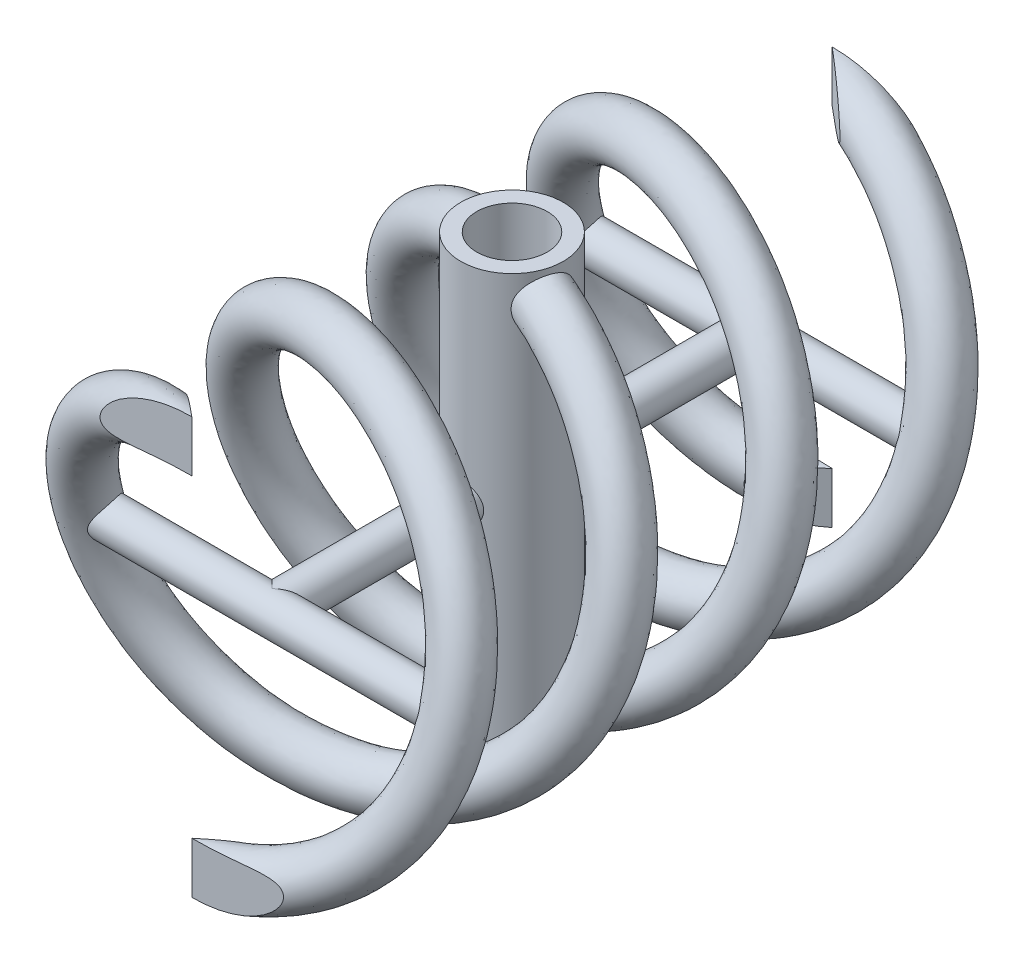
from build123d import *

# Parameters (mm, degrees)
SWEEP1_PITCH            = 4.999999999999991
SWEEP1_HEIGHT           = 10.000000000000004
SWEEP1_RADIUS           = 2.85
SWEEP1_START_ANGLE      = 90.00000000000018
SWEEP1_PROFILE_R        = 0.4
BODY_MOVE_COPY1_ANGLE   = 179.99999999999963
SKETCH26_R              = 0.3000000000000001
BOSS_EXTRUDE5_DEPTH     = 3
SKETCH26_R_2            = 0.2999999999999999
BOSS_EXTRUDE5_2_DEPTH   = 3
SKETCH31_R              = 0.8000000000000002
BOSS_EXTRUDE6_DEPTH     = 3.25
CUT_EXTRUDE1_DEPTH      = 12.356879079048607
CUT_EXTRUDE1_DEPTH_BACK = 12.356879079048607
CUT_EXTRUDE2_DEPTH      = 12.005680445037603
CUT_EXTRUDE2_DEPTH_BACK = 12.005680445037603
CUT_EXTRUDE8_DEPTH      = 13.361735424619113
CUT_EXTRUDE8_DEPTH_BACK = 2
CUT_EXTRUDE10_DEPTH     = 2
SKETCH35_R              = 0.3
BOSS_EXTRUDE7_DEPTH     = 3.75
SKETCH33_R              = 0.55
CUT_EXTRUDE11_DEPTH     = 10


with BuildPart() as part:
    # Sweep1: sweep along a helix
    with BuildLine() as sweep1_path:
        add(Helix(SWEEP1_PITCH, SWEEP1_HEIGHT, SWEEP1_RADIUS, center=(0, 0, 0), direction=(0, 0, 1), lefthand=True, mode=Mode.PRIVATE).rotate(Axis((0, 0, 0), (0, 0, 1)), SWEEP1_START_ANGLE))
    # Sweep1 profile (on start of the path) → Sweep1 (sweep)
    with BuildSketch(Plane(origin=(-9.05e-15, 2.850000000000001, 0), x_dir=(-0.26893249196120517, 0, 0.9631590288044527), z_dir=(0.9631590288044527, 2.1760873204914477e-13, 0.26893249196120517))):
        Circle(SWEEP1_PROFILE_R)
    sweep(path=sweep1_path.line, is_frenet=True)


with BuildPart() as body_2:
    # Body-Move/Copy1: copy of part
    add(part.part.rotate(Axis((0, 0, 0), (0, 0, 1)), BODY_MOVE_COPY1_ANGLE))


with BuildPart() as body_3:
    # Sketch26 → Boss-Extrude5 (new, symmetric)
    with BuildSketch(Plane(origin=(0, 0, 0), x_dir=(0, 0, -1), z_dir=(1, 0, 0))):
        with Locations((-8.7499999998068, -6.918042e-10)):
            Circle(SKETCH26_R)
    extrude(amount=BOSS_EXTRUDE5_DEPTH, both=True)


with BuildPart() as body_4:
    # Sketch26 → Boss-Extrude5 2 (new, symmetric)
    with BuildSketch(Plane(origin=(0, 0, 0), x_dir=(0, 0, -1), z_dir=(1, 0, 0))):
        with Locations((-1.2500000001931852, -6.9180504e-10)):
            Circle(SKETCH26_R_2)
    extrude(amount=BOSS_EXTRUDE5_2_DEPTH, both=True)


with BuildPart() as part_1:
    add(part.part)

    add(body_2.part)  # Boss-Extrude6 merges body 2
    # Sketch31 → Boss-Extrude6 (add, symmetric)
    with BuildSketch(Plane(origin=(0, 0, 0), x_dir=(1, 0, 0), z_dir=(0, 1, 0))):
        with Locations(Location((0, -4.999999999999996, 0), (0, 0, 270))):
            Circle(SKETCH31_R)
    extrude(amount=BOSS_EXTRUDE6_DEPTH, both=True)

    # Sketch14 → Cut-Extrude1 (cut, two sides: drawn at the far end of the back side and taken through both)
    with BuildSketch(Plane(origin=(0, 0, 0), x_dir=(0, 0, -1), z_dir=(1, 0, 0)).offset(-CUT_EXTRUDE1_DEPTH_BACK)):
        Polygon((-10, 0), (-10, 4.202907868977859), (-11.256184262643037, 4.202907868977859), (-11.256184262643037, -3.5466151326685815), (-10, -3.5466151326685815), align=None)
    extrude(amount=CUT_EXTRUDE1_DEPTH + CUT_EXTRUDE1_DEPTH_BACK, mode=Mode.SUBTRACT)

    # Sketch15 → Cut-Extrude2 (cut, two sides: drawn at the far end of the back side and taken through both)
    with BuildSketch(Plane(origin=(0, 0, 0), x_dir=(0, 0, -1), z_dir=(1, 0, 0)).offset(-CUT_EXTRUDE2_DEPTH_BACK)):
        Polygon((0, 0), (0, 4.564855857785396), (2.0707326657358056, 4.564855857785396), (2.0707326657358056, -3.8182047907109737), (0, -3.8182047907109737), align=None)
    extrude(amount=CUT_EXTRUDE2_DEPTH + CUT_EXTRUDE2_DEPTH_BACK, mode=Mode.SUBTRACT)

    # Sketch17 → Cut-Extrude8 (cut, two sides: drawn at the far end of the back side and taken through both)
    with BuildSketch(Plane(origin=(0, 3.25, 0), x_dir=(1, 0, 0), z_dir=(0, 1, 0)).offset(-CUT_EXTRUDE8_DEPTH_BACK)):
        Polygon((-1.149e-14, -10), (0.5721096823204346, -10), (0.5721096823204345, -8.804415045983045), (-1.4248426642013179, -8.804415045983045), align=None)
        Polygon((0, 0), (-0.5721096823204461, -7e-17), (-0.5721096823204459, -1.1955849540169547), (1.4248426642013063, -1.1955849540169547), align=None)
    extrude(amount=CUT_EXTRUDE8_DEPTH + CUT_EXTRUDE8_DEPTH_BACK, mode=Mode.SUBTRACT)

    # Sketch19 → Cut-Extrude10 (cut)
    with BuildSketch(Plane(origin=(0, -3.25, 0), x_dir=(1, 0, 0), z_dir=(0, 1, 0))):
        Polygon((3.403e-14, 0), (0.5164080832682824, 0), (0.5164080832682825, -1.1955849540169556), (-1.424842664201272, -1.1955849540169554), align=None)
        Polygon((3.442e-14, -10), (-0.3580298797536997, -10), (-0.37295704346254427, -10), (-0.37295704346254427, -8.804415045983045), (1.42484266420134, -8.804415045983045), align=None)
    extrude(amount=CUT_EXTRUDE10_DEPTH, mode=Mode.SUBTRACT)

    add(body_3.part)  # Boss-Extrude7 merges body 3

    add(body_4.part)  # Boss-Extrude7 merges body 4
    # Sketch35 → Boss-Extrude7 (add, symmetric)
    with BuildSketch(Plane.XY.offset(5)):
        with Locations(Location((0, 0, 0), (0, 0, 269.999999982))):
            Circle(SKETCH35_R)
    extrude(amount=BOSS_EXTRUDE7_DEPTH, both=True)

    # Sketch33 → Cut-Extrude11 (cut)
    with BuildSketch(Plane(origin=(0, 3.25, 0), x_dir=(1, 0, 0), z_dir=(0, 1, 0))):
        with Locations(Location((-1.124e-14, -4.999999999999999, 0), (0, 0, 270))):
            Circle(SKETCH33_R)
    extrude(amount=-CUT_EXTRUDE11_DEPTH, mode=Mode.SUBTRACT)


solid = part_1.part
